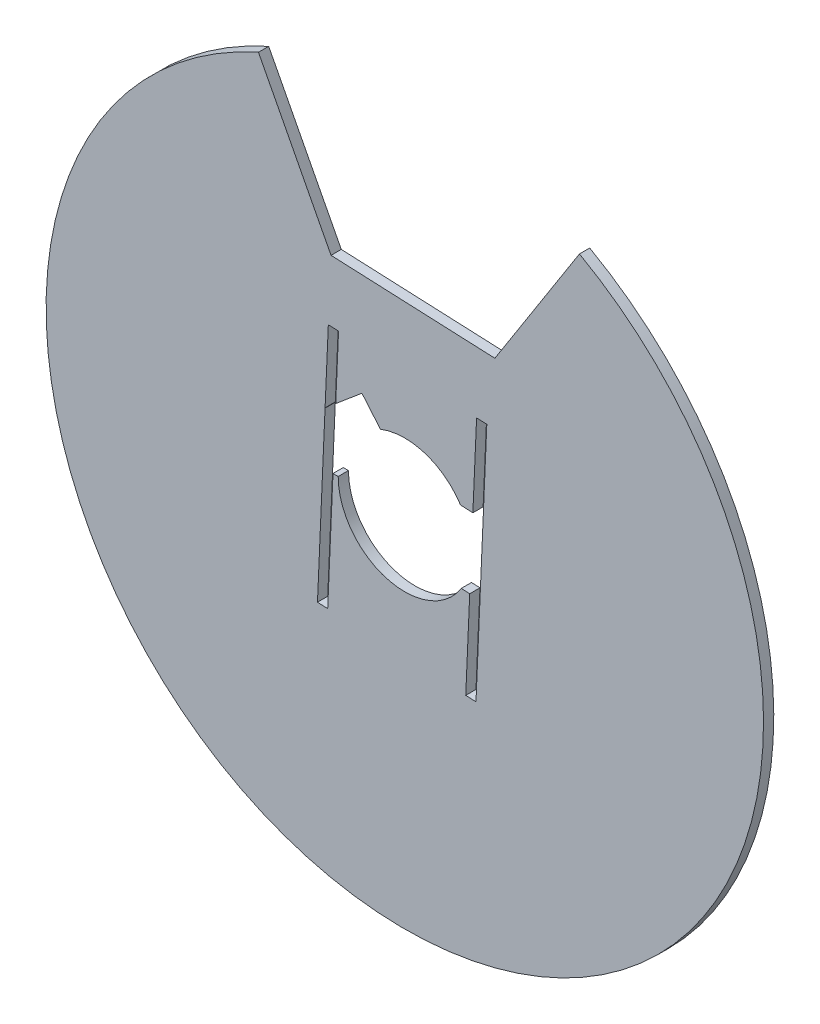
from build123d import *

# Parameters (mm, degrees)
ESQUISSE1_R             = 175
BOSS_EXTRU_1_DEPTH      = 5
ENL_V_START             = -10
ENL_V_MAT_EXTRU_1_DEPTH = 10


with BuildPart() as part:
    # Esquisse1 → Boss.-Extru.1 (new body)
    with BuildSketch(Plane.XY):
        Circle(ESQUISSE1_R)
        with BuildLine():
            Line((-20.91966999, 40.95026504), (-11.899961997, 30.243030676))
            ThreePointArc((-11.899961997, 30.243030676), (9.877796967, 30.962543937), (27.21544776, 17.764273225))
            Line((27.21544776, 17.764273225), (33.203827505, 17.5))
            Line((33.203827505, 17.5), (35.013781495, 58.513204539))
            Line((35.013781495, 58.513204539), (40.008919731, 58.292764062))
            Line((40.008919731, 58.292764062), (34.718348278, -61.590553601))
            Line((34.718348278, -61.590553601), (29.723210042, -61.370113123))
            Line((29.723210042, -61.370113123), (31.660744165, -17.465967651))
            Line((31.660744165, -17.465967651), (27.523349483, -17.283380261))
            ThreePointArc((27.523349483, -17.283380261), (-8.99280662, -31.231065129), (-32.5, 0))
            Line((-32.5, 0), (-35.034065472, 0))
            Line((-35.034065472, 0), (-37.611253378, -58.398575491))
            Line((-37.611253378, -58.398575491), (-42.606391614, -58.178135013))
            Line((-42.606391614, -58.178135013), (-38.906758812, 25.654822978))
            Line((-38.906758812, 25.654822978), (-38.97733315, 25.738601298))
            Line((-38.97733315, 25.738601298), (-38.900193886, 25.803582937))
            Line((-38.900193886, 25.803582937), (-37.315820161, 61.705182649))
            Line((-37.315820161, 61.705182649), (-32.320681925, 61.484742172))
            Line((-32.320681925, 61.484742172), (-33.702084088, 30.182438475))
            Line((-33.702084088, 30.182438475), (-20.91966999, 40.95026504))
        make_face(mode=Mode.SUBTRACT)
    extrude(amount=BOSS_EXTRU_1_DEPTH)

    # Esquisse2 → Enlèv. mat.-Extru.1 (cut)
    with BuildSketch(Plane.XY.offset(5).offset(ENL_V_START)):
        with BuildLine():
            Line((43.929034477, 88.148964429), (85.197600084, 152.860619324))
            ThreePointArc((85.197600084, 152.860619324), (7.715416702, 174.829838257), (-71.400831554, 159.771465705))
            Line((-71.400831554, 159.771465705), (-35.993177298, 91.676012064))
            Line((-35.993177298, 91.676012064), (43.929034477, 88.148964429))
        make_face()
    extrude(amount=ENL_V_MAT_EXTRU_1_DEPTH, mode=Mode.SUBTRACT)


solid = part.part
